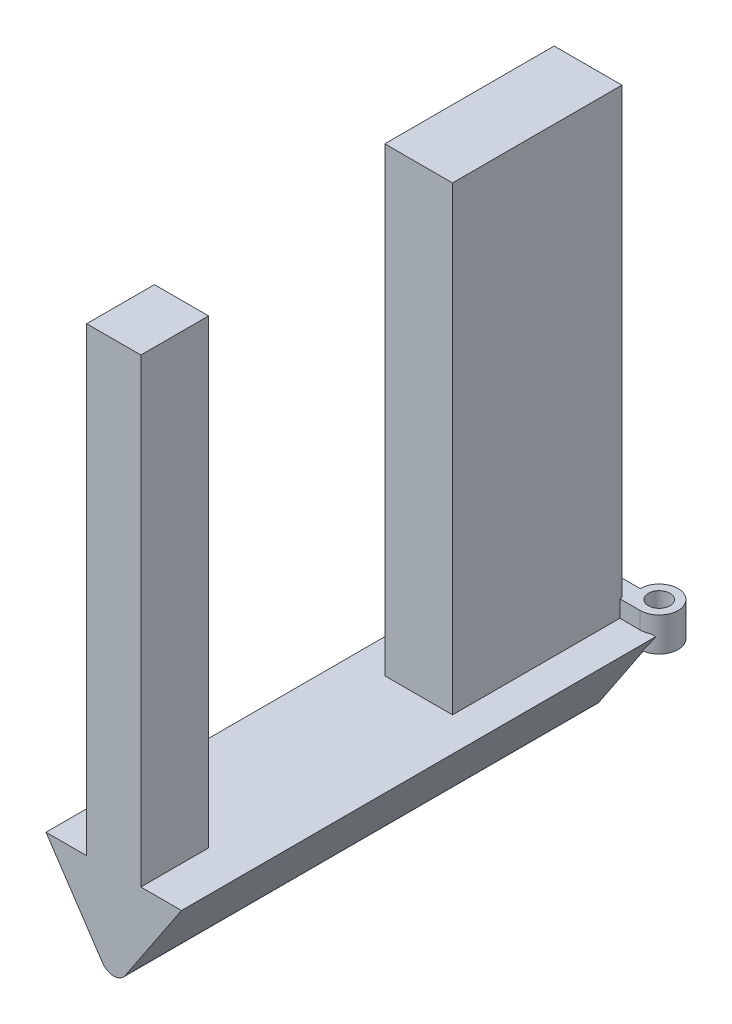
from build123d import *

# Parameters (mm, degrees)
EXTRUDE_1_DEPTH = 70
SKETCH_2_W      = 10
SKETCH_2_H      = 8
EXTRUDE_2_DEPTH = 25
SKETCH_3_W      = 8
SKETCH_3_H      = 8
EXTRUDE_3_DEPTH = 10
SKETCH_5_R      = 1.6
EXTRUDE_4_DEPTH = 2.5
FILLET_1_R      = 2
SKETCH_6_W      = 10
SKETCH_6_H      = 25
EXTRUDE_5_DEPTH = 60
SKETCH_7_W      = 8
SKETCH_7_H      = 10
EXTRUDE_6_DEPTH = 60


with BuildPart() as part:
    # 草图1 → 凸台-拉伸1 (new body)
    with BuildSketch(Plane.XY):
        Polygon((0, -15), (10, 0), (-10, 0), align=None)
    extrude(amount=EXTRUDE_1_DEPTH)

    # 草图2 → 凸台-拉伸2 (add)
    with BuildSketch(Plane.XY):
        with Locations((0, 4)):
            Rectangle(SKETCH_2_W, SKETCH_2_H)
    extrude(amount=EXTRUDE_2_DEPTH)

    # 草图3 → 凸台-拉伸3 (add)
    with BuildSketch(Plane.XY.offset(70)):
        with Locations((0, 4)):
            Rectangle(SKETCH_3_W, SKETCH_3_H)
    extrude(amount=-EXTRUDE_3_DEPTH)

    # 草图5 → 凸台-拉伸4 (add, symmetric)
    with BuildSketch(Plane.XZ):
        with BuildLine():
            Line((-5.2, -2.5), (5.2, -2.5))
            ThreePointArc((5.2, -2.5), (9.979898987, -4.479898987), (8, 0.3))
            Line((8, 0.3), (-8, 0.3))
            ThreePointArc((-8, 0.3), (-9.979898987, -4.479898987), (-5.2, -2.5))
        make_face()
        with Locations((-8, -2.5)):
            Circle(SKETCH_5_R, mode=Mode.SUBTRACT)
        with Locations((8, -2.5)):
            Circle(SKETCH_5_R, mode=Mode.SUBTRACT)
    extrude(amount=EXTRUDE_4_DEPTH, both=True)

    # 圆角1
    fillet_1_edges = [part.edges().sort_by_distance(p)[0] for p in [
        (0, -15, 35),
    ]]
    fillet(fillet_1_edges, radius=FILLET_1_R)

    # 草图6 → 凸台-拉伸5 (add)
    with BuildSketch(Plane(origin=(0, 8, 0), x_dir=(1, 0, 0), z_dir=(0, 1, 0))):
        with Locations((0, -12.5)):
            Rectangle(SKETCH_6_W, SKETCH_6_H)
    extrude(amount=EXTRUDE_5_DEPTH)

    # 草图7 → 凸台-拉伸6 (add)
    with BuildSketch(Plane(origin=(0, 8, 0), x_dir=(1, 0, 0), z_dir=(0, 1, 0))):
        with Locations((0, -65)):
            Rectangle(SKETCH_7_W, SKETCH_7_H)
    extrude(amount=EXTRUDE_6_DEPTH)


solid = part.part
